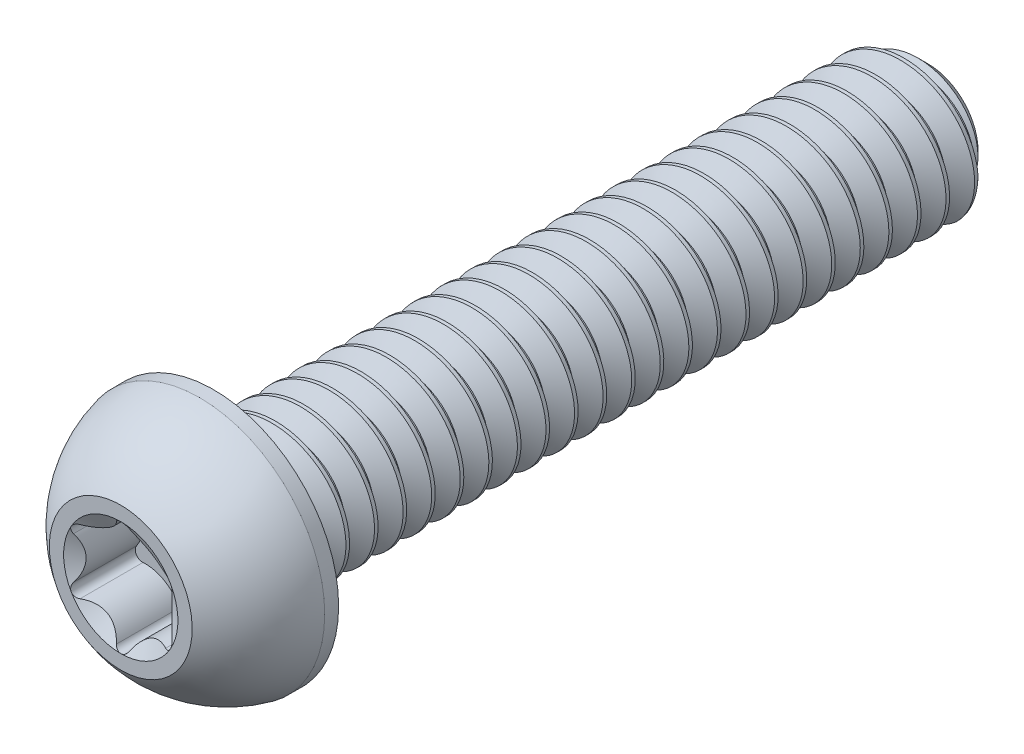
from build123d import *

# Parameters (mm, degrees)
SKETCH1_W          = 10
SKETCH1_H          = 1
CHAMFER1_SIZE      = 0.3
CUT_SWEEP1_PITCH   = 0.4
CUT_EXTRUDE4_DEPTH = 0.91
CIRPATTERN1_COUNT  = 6


with BuildPart() as part:
    # Sketch1 → Revolve1 (revolve)
    with BuildSketch(Plane(origin=(0, 0, 0), x_dir=(0, 0, -1), z_dir=(1, 0, 0))):
        with Locations((6.3, 0.5)):
            Rectangle(SKETCH1_W, SKETCH1_H)
    revolve(axis=Axis((0, 0, -11.3), (0, 0, 1)))

    # Chamfer1
    chamfer1_edges = [part.edges().sort_by_distance(p)[0] for p in [
        (0, -1, -11.3),
    ]]
    chamfer(chamfer1_edges, length=CHAMFER1_SIZE)

    # Cut-Sweep1: the profile of Sketch2 profile screwed along a right-hand helix of 26 turns, 6 arcs to a turn; built about Z, then put on its axis
    cut_sweep1_z = Axis((0, 0, 0), (0, 0, 1))
    cut_sweep1_corners = [(1.0003, 0, 0.000173205), (1.0003, 0, -0.350173205), (0.740192379, 0, -0.2), (0.740192379, 0, -0.15)]
    with BuildLine(mode=Mode.PRIVATE) as cut_sweep1_profile:
        Line(cut_sweep1_corners[0], cut_sweep1_corners[1])
        Line(cut_sweep1_corners[1], cut_sweep1_corners[2])
        Line(cut_sweep1_corners[2], cut_sweep1_corners[3])
        Line(cut_sweep1_corners[3], cut_sweep1_corners[0])
    cut_sweep1_cap = Face(cut_sweep1_profile.wire())
    cut_sweep1_turn_angles = [0, 30, 60, 90, 120, 150, 180, 210, 240, 270, 300, 330, 360]
    cut_sweep1_turn_weights = [1, 0.8660254037844387, 1, 0.8660254037844387, 1, 0.8660254037844387, 1, 0.8660254037844387, 1, 0.8660254037844387, 1, 0.8660254037844387, 1]
    cut_sweep1_turn_rails = [Edge.make_bspline([Vector(p[0], p[1], 0).rotate(cut_sweep1_z, cut_sweep1_turn_angles[k]) / cut_sweep1_turn_weights[k] + Vector(0, 0, p[2] + CUT_SWEEP1_PITCH * cut_sweep1_turn_angles[k] / 360) for k in range(13)], [0, 0, 0, 1, 1, 2, 2, 3, 3, 4, 4, 5, 5, 6, 6, 6], 2, cut_sweep1_turn_weights) for p in cut_sweep1_corners]
    cut_sweep1_turn_sides = [Face.make_surface_from_curves(cut_sweep1_turn_rails[p[0]], cut_sweep1_turn_rails[p[1]]) for p in [(0, 1), (1, 2), (2, 3), (3, 0)]]
    cut_sweep1 = Plane(origin=(0, 0, -11.3), x_dir=(0, 1, 0), z_dir=(0, 0, 1)) * Solid(Shell([*[p.moved(Location((0, 0, CUT_SWEEP1_PITCH * i))) for i in range(26) for p in cut_sweep1_turn_sides], cut_sweep1_cap, cut_sweep1_cap.rotate(cut_sweep1_z, 9360).moved(Location((0, 0, CUT_SWEEP1_PITCH * 9360 / 360)))]))
    add(cut_sweep1, mode=Mode.SUBTRACT)

    # Sketch7 → Revolve2 (revolve)
    with BuildSketch(Plane(origin=(0, 0, 0), x_dir=(0, 0, -1), z_dir=(1, 0, 0)), mode=Mode.PRIVATE) as revolve2_sk:
        with BuildLine():
            Line((1.105, 1.75), (1.3, 1.75))
            Line((1.3, 1.75), (1.3, 0))
            Line((1.3, 0), (0, 0))
            Line((0, 0), (0, 1))
            ThreePointArc((0, 1), (0.479976957, 1.481850617), (1.105, 1.75))
        make_face()
    revolve(revolve2_sk.sketch.rotate(Axis((0, 0, 0), (0, 0, -1)), 189.336081704), axis=Axis((0, 0, 0), (0, 0, -1)))

    # Sketch11 → Cut-Extrude4 (cut)
    with BuildSketch(Plane.XY):
        with BuildLine():
            Line((0, 0), (-0.692820323, 0.4))
            ThreePointArc((-0.692820323, 0.4), (-0.706163843, 0.346715947), (-0.68935124, 0.294422772))
            ThreePointArc((-0.68935124, 0.294422772), (-0.6, 0), (-0.68935124, -0.294422772))
            ThreePointArc((-0.68935124, -0.294422772), (-0.706163843, -0.346715947), (-0.692820323, -0.4))
            Line((-0.692820323, -0.4), (0, 0))
        make_face()
    cut_extrude4 = extrude(amount=-CUT_EXTRUDE4_DEPTH, mode=Mode.SUBTRACT)

    # CirPattern1: Cut-Extrude4 ×6 about axis
    cirpattern1_axis = Axis((0, 0, 0), (0, 0, 1))
    for i in range(1, CIRPATTERN1_COUNT):
        add(cut_extrude4.rotate(cirpattern1_axis, i * 360 / CIRPATTERN1_COUNT), mode=Mode.SUBTRACT)

    # Cut-Extrude3 cone 1 section (through the dimple's axis) → Cut-Extrude3 (revolve, cut)
    with BuildSketch(Plane(origin=(0, 0, 0), x_dir=(0, -1, 0), z_dir=(1, 0, 0))):
        Polygon((0, 0), (0.8, 0), (0, 0.461880215), align=None)
    revolve(axis=Axis((0, 0, 0), (0, 0, -1)), mode=Mode.SUBTRACT)


solid = part.part
